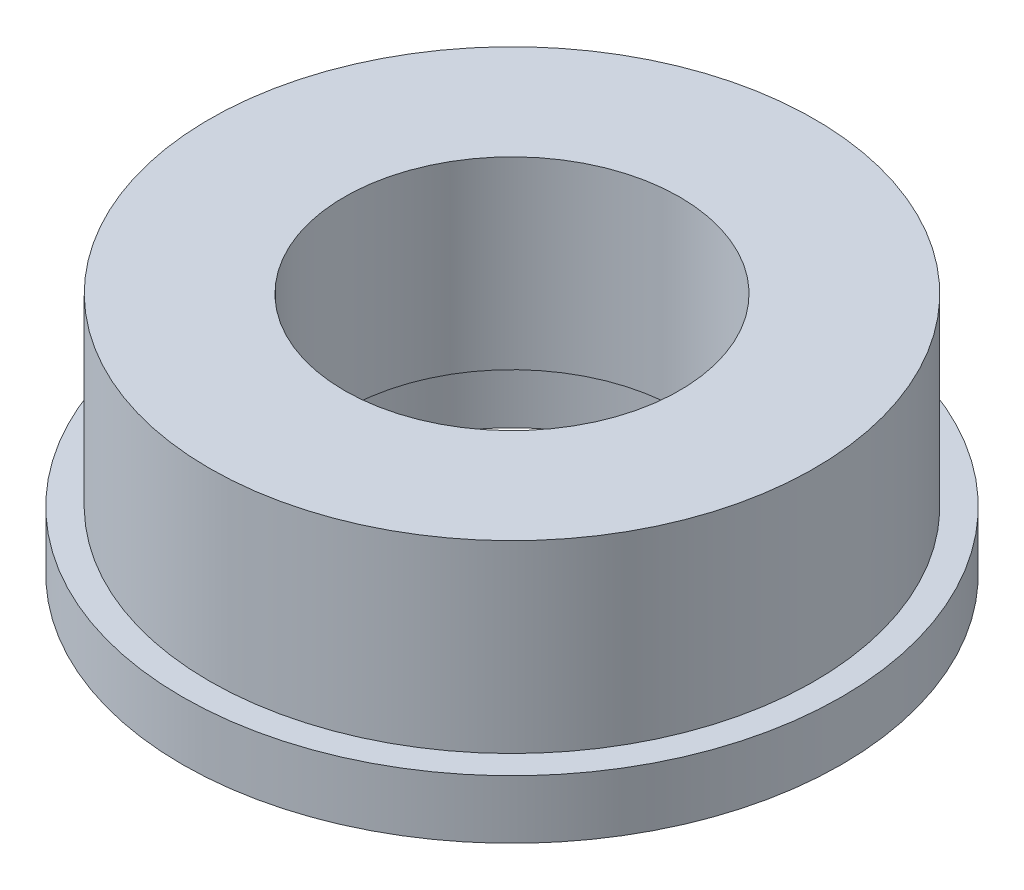
from build123d import *


with BuildPart() as part:
    # Sketch2 → Revolve1 (revolve)
    with BuildSketch(Plane(origin=(0, 0, 0), x_dir=(0, 1, 0), z_dir=(0, 0, 1))):
        Polygon((0, 53.66), (-9.525, 53.66), (-9.525, 29.1925), (0, 29.1925), (0, 27.2875), (30, 27.2875), (30, 49.23), (0, 49.23), align=None)
    revolve(axis=Axis((0, 52.97625, 0), (0, -1, 0)))


solid = part.part
